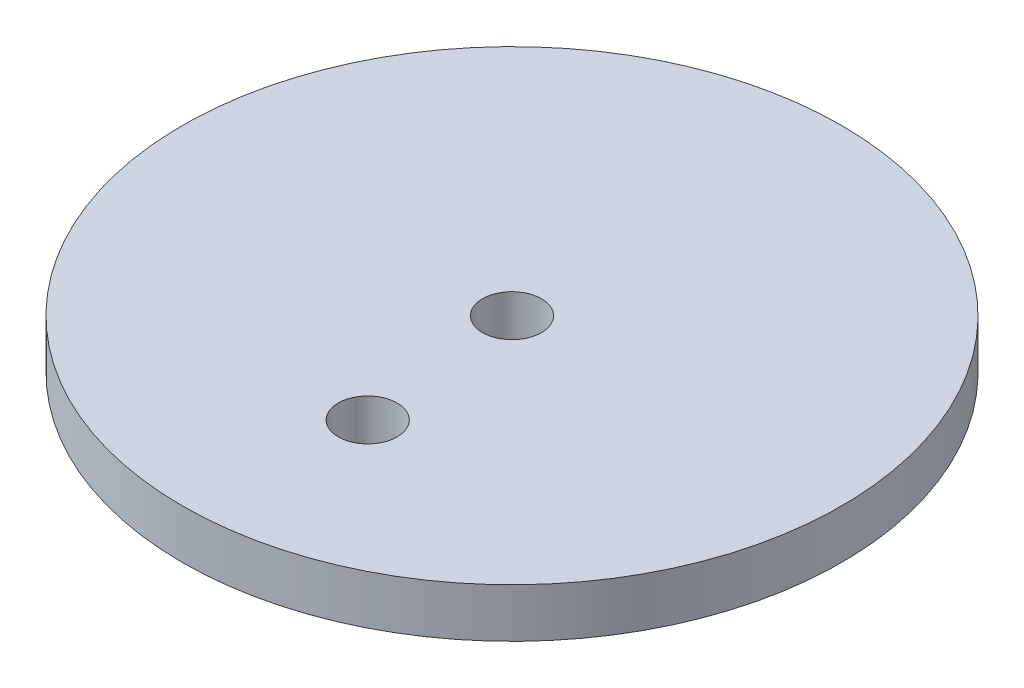
from build123d import *

# Parameters (mm, degrees)
SKETCH1_W          = 18.364886743
SKETCH1_H          = 3
SKETCH2_R          = 1.8
CUT_EXTRUDE1_DEPTH = 10


with BuildPart() as part:
    # Sketch1 → Revolve1 (revolve)
    with BuildSketch(Plane.XY):
        with Locations((10.982443372, 7.898101992)):
            Rectangle(SKETCH1_W, SKETCH1_H)
    revolve(axis=Axis((0, 9.398101992, 0), (0, -1, 0)))

    # Sketch2 → Cut-Extrude1 (cut)
    with BuildSketch(Plane(origin=(0, 9.398101992, 0), x_dir=(1, 0, 0), z_dir=(0, 1, 0))):
        with Locations((1.10990846, -9.938214287)):
            Circle(SKETCH2_R)
    extrude(amount=-CUT_EXTRUDE1_DEPTH, mode=Mode.SUBTRACT)


solid = part.part
